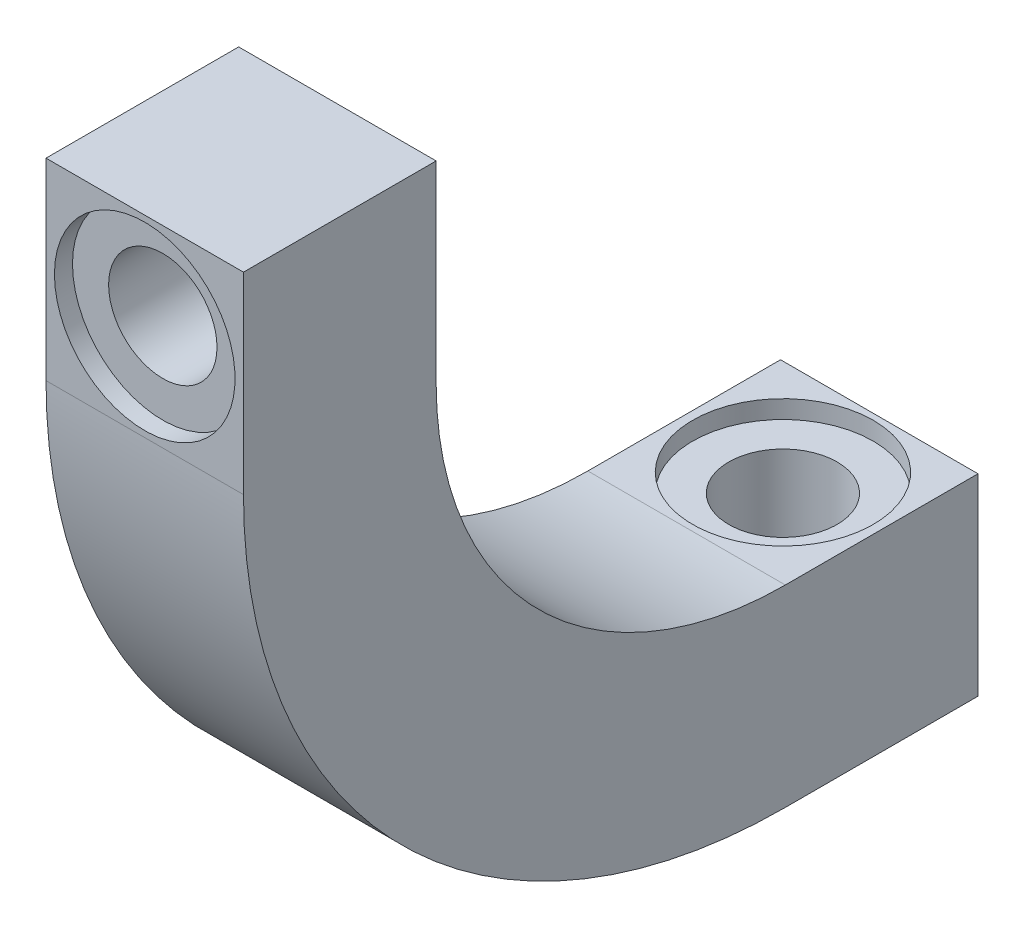
from build123d import *

# Parameters (mm, degrees)
BOSS_EXTRUDE1_DEPTH      = 4.1
BOSS_EXTRUDE1_DEPTH_BACK = 4.1
SKETCH7_R                = 1.75
CUT_EXTRUDE1_DEPTH       = 38.700265251
SKETCH8_R                = 1.75
CUT_EXTRUDE2_DEPTH       = 38.700265251
SKETCH11_R               = 2.25
CUT_EXTRUDE6_DEPTH       = 6
SKETCH12_R               = 2.25
CUT_EXTRUDE7_DEPTH       = 6
SKETCH13_R               = 3.75
CUT_EXTRUDE8_DEPTH       = 0.75
SKETCH14_R               = 3.75
CUT_EXTRUDE10_DEPTH      = 0.75


with BuildPart() as part:
    # Sketch5 → Boss-Extrude1 (new, two sides: drawn at the far end of the back side and taken through both)
    with BuildSketch(Plane(origin=(0, 0, 0), x_dir=(0, 0, -1), z_dir=(1, 0, 0)).offset(-BOSS_EXTRUDE1_DEPTH_BACK)):
        with BuildLine():
            Line((-18.5, 4), (-18.5, 0))
            Line((-18.5, 0), (-18.5, -4))
            ThreePointArc((-18.5, -4), (-14.253048327, -14.253048327), (-4, -18.5))
            Line((-4, -18.5), (0, -18.5))
            Line((0, -18.5), (4, -18.5))
            Line((4, -18.5), (4, -26.5))
            Line((4, -26.5), (-4, -26.5))
            ThreePointArc((-4, -26.5), (-19.909902577, -19.909902577), (-26.5, -4))
            Line((-26.5, -4), (-26.5, 4))
            Line((-26.5, 4), (-18.5, 4))
        make_face()
    extrude(amount=BOSS_EXTRUDE1_DEPTH + BOSS_EXTRUDE1_DEPTH_BACK)

    # Sketch7 → Cut-Extrude1 (cut, through all)
    with BuildSketch(Plane.XY):
        Circle(SKETCH7_R)
    extrude(amount=CUT_EXTRUDE1_DEPTH, mode=Mode.SUBTRACT)

    # Sketch8 → Cut-Extrude2 (cut, through all)
    with BuildSketch(Plane(origin=(0, 0, 0), x_dir=(1, 0, 0), z_dir=(0, 1, 0))):
        Circle(SKETCH8_R)
    extrude(amount=-CUT_EXTRUDE2_DEPTH, mode=Mode.SUBTRACT)

    # Sketch11 → Cut-Extrude6 (cut)
    with BuildSketch(Plane.XZ.offset(18.5)):
        Circle(SKETCH11_R)
    extrude(amount=CUT_EXTRUDE6_DEPTH, mode=Mode.SUBTRACT)

    # Sketch12 → Cut-Extrude7 (cut)
    with BuildSketch(Plane.XY.offset(26.5)):
        Circle(SKETCH12_R)
    extrude(amount=-CUT_EXTRUDE7_DEPTH, mode=Mode.SUBTRACT)

    # Sketch13 → Cut-Extrude8 (cut)
    with BuildSketch(Plane.XZ.offset(18.5)):
        Circle(SKETCH13_R)
    extrude(amount=CUT_EXTRUDE8_DEPTH, mode=Mode.SUBTRACT)

    # Sketch14 → Cut-Extrude10 (cut)
    with BuildSketch(Plane(origin=(0, 0, 26.5), x_dir=(1, 0, 0), z_dir=(0, 0, -1))):
        Circle(SKETCH14_R)
    extrude(amount=CUT_EXTRUDE10_DEPTH, mode=Mode.SUBTRACT)


solid = part.part
